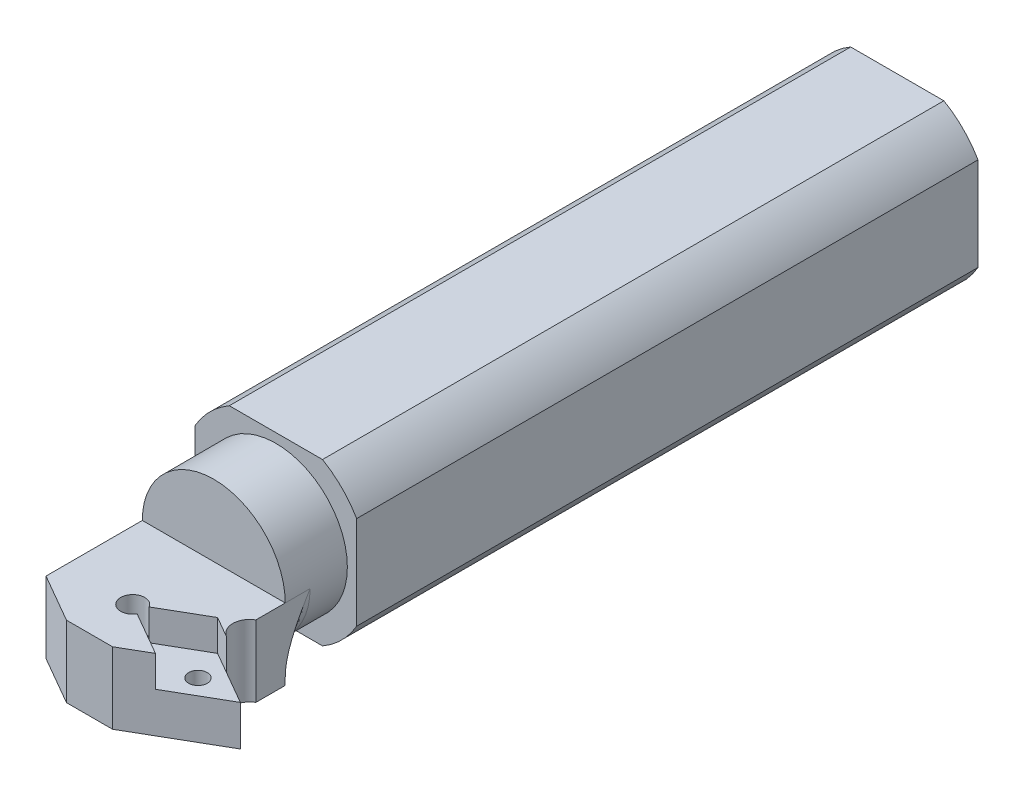
from build123d import *

# Parameters (mm, degrees)
EXTRUDE_1_DEPTH     = 100
SKETCH_2_R          = 11.5
EXTRUDE_2_DEPTH     = 10
SKETCH_3_W          = 23
SKETCH_3_H          = 11.5
EXTRUDE_3_DEPTH     = 20
FILLET_3_R          = 4
FILLET_4_R          = 4
CUT_EXTRUDE_1_DEPTH = 132.291660154
EXTRUDE_4_DEPTH     = 11.5
CUT_EXTRUDE_2_DEPTH = 20
CUT_EXTRUDE_3_DEPTH = 5
SKETCH_8_R          = 1.5
CUT_EXTRUDE_4_DEPTH = 133.303102986


with BuildPart() as part:
    # 草图1 → 凸台-拉伸1 (new body)
    with BuildSketch(Plane.XY):
        with BuildLine():
            Line((-7.5, 12.990381057), (7.5, 12.990381057))
            ThreePointArc((7.5, 12.990381057), (10.606601718, 10.606601718), (12.990381057, 7.5))
            Line((12.990381057, 7.5), (12.990381057, -7.5))
            ThreePointArc((12.990381057, -7.5), (10.606601718, -10.606601718), (7.5, -12.990381057))
            Line((7.5, -12.990381057), (-7.5, -12.990381057))
            ThreePointArc((-7.5, -12.990381057), (-10.606601718, -10.606601718), (-12.990381057, -7.5))
            Line((-12.990381057, -7.5), (-12.990381057, 7.5))
            ThreePointArc((-12.990381057, 7.5), (-10.606601718, 10.606601718), (-7.5, 12.990381057))
        make_face()
    extrude(amount=EXTRUDE_1_DEPTH)

    # 草图2 → 凸台-拉伸2 (add)
    with BuildSketch(Plane.XY.offset(100)):
        Circle(SKETCH_2_R)
    extrude(amount=EXTRUDE_2_DEPTH)

    # 草图3 → 凸台-拉伸3 (add)
    with BuildSketch(Plane.XY.offset(110)):
        with Locations((0, -5.75)):
            Rectangle(SKETCH_3_W, SKETCH_3_H)
    extrude(amount=EXTRUDE_3_DEPTH)

    # 圆角3
    # the kernel refuses this fillet: 4 mm, written as the material it adds along each edge
    with BuildSketch(Plane(origin=(0, 0, 110), x_dir=(0, -1, 0), z_dir=(-1, 0, 0))) as fillet_3_piece_1_section:
        with BuildLine():
            CenterArc((11.5 + FILLET_3_R, -FILLET_3_R), FILLET_3_R, 90, 90)
            Line((11.5 + FILLET_3_R, 0), (11.5, 0))
            Line((11.5, 0), (11.5, -FILLET_3_R))
        make_face()
    fillet_3_piece_1 = revolve(axis=Axis((0, 0, 110), (0, 0, 1)), revolution_arc=90, mode=Mode.PRIVATE)
    fillet_3_piece_1 = split(fillet_3_piece_1, bisect_by=Plane(origin=(8.245599316, -11.5, 108.963397676), z_dir=(0, 1, 0)), keep=Keep.TOP, mode=Mode.PRIVATE)
    fillet_3_piece_1 = split(fillet_3_piece_1, bisect_by=Plane(origin=(11.5, -8.245600634, 108.963397676), z_dir=(-1, 0, 0)), keep=Keep.TOP, mode=Mode.PRIVATE)
    add(fillet_3_piece_1)

    # 圆角4
    # the kernel refuses this fillet: 4 mm, written as the material it adds along each edge
    with BuildSketch(Plane(origin=(0, 0, 110), x_dir=(-1, 0, 0), z_dir=(0, 1, 0))) as fillet_4_piece_1_section:
        with BuildLine():
            CenterArc((11.5 + FILLET_4_R, -FILLET_4_R), FILLET_4_R, 90, 90)
            Line((11.5 + FILLET_4_R, 0), (11.5, 0))
            Line((11.5, 0), (11.5, -FILLET_4_R))
        make_face()
    fillet_4_piece_1 = revolve(axis=Axis((0, 0, 110), (0, 0, 1)), revolution_arc=139.842431039, mode=Mode.PRIVATE)
    fillet_4_piece_1 = split(fillet_4_piece_1, bisect_by=Plane(origin=(-8.245600113, -11.5, 108.963397741), z_dir=(0, 1, 0)), keep=Keep.TOP, mode=Mode.PRIVATE)
    fillet_4_piece_1 = split(fillet_4_piece_1, bisect_by=Plane(origin=(11.5, -8.245601202, 108.963397741), z_dir=(-1, 0, 0)), keep=Keep.TOP, mode=Mode.PRIVATE)
    fillet_4_piece_1 = split(fillet_4_piece_1, bisect_by=Plane(origin=(-11.5, -8.245601202, 108.963397741), z_dir=(1, 0, 0)), keep=Keep.TOP, mode=Mode.PRIVATE)
    add(fillet_4_piece_1)

    # 草图4 → 切除-拉伸1 (cut, through all)
    with BuildSketch(Plane(origin=(0, 0, 0), x_dir=(1, 0, 0), z_dir=(0, 1, 0))):
        Polygon((3.705771366, -130), (11.5, -125.5), (11.5, -130), align=None)
        Polygon((-11.5, -130), (-3.705771366, -130), (-11.5, -125.5), align=None)
    extrude(amount=-CUT_EXTRUDE_1_DEPTH, mode=Mode.SUBTRACT)

    # 草图5 → 凸台-拉伸4 (add)
    with BuildSketch(Plane(origin=(0, 0, 0), x_dir=(1, 0, 0), z_dir=(0, 1, 0))):
        Polygon((11.5, -125.5), (16.746857011, -122.470725692), (11.5, -119.441451384), align=None)
    extrude(amount=-EXTRUDE_4_DEPTH)

    # 草图6 → 切除-拉伸2 (cut)
    with BuildSketch(Plane(origin=(0, 0, 0), x_dir=(1, 0, 0), z_dir=(0, 1, 0))):
        with BuildLine():
            Line((11.5, -114.720725692), (11.5, -119.441451384))
            ThreePointArc((11.5, -119.441451384), (10.137243875, -117.081088538), (11.5, -114.720725692))
        make_face()
    extrude(amount=-CUT_EXTRUDE_2_DEPTH, mode=Mode.SUBTRACT)

    # 草图7 → 切除-拉伸3 (cut)
    with BuildSketch(Plane(origin=(0, 0, 0), x_dir=(1, 0, 0), z_dir=(0, 1, 0))):
        with BuildLine():
            Line((16.746857011, -122.470725692), (8.086602973, -127.470725692))
            Line((8.086602973, -127.470725692), (1.102060707, -123.438198334))
            ThreePointArc((1.102060707, -123.438198334), (-2.508596349, -122.470725692), (1.102060707, -121.50325305))
            Line((1.102060707, -121.50325305), (8.086602973, -117.470725692))
            Line((8.086602973, -117.470725692), (16.746857011, -122.470725692))
        make_face()
    extrude(amount=-CUT_EXTRUDE_3_DEPTH, mode=Mode.SUBTRACT)

    # 草图8 → 切除-拉伸4 (cut, through all)
    with BuildSketch(Plane(origin=(0, -5, 0), x_dir=(1, 0, 0), z_dir=(0, 1, 0))):
        with Locations(Location((9.926348936, -122.470725692, 0), (0, 0, 270))):
            Circle(SKETCH_8_R)
    extrude(amount=-CUT_EXTRUDE_4_DEPTH, mode=Mode.SUBTRACT)


solid = part.part
